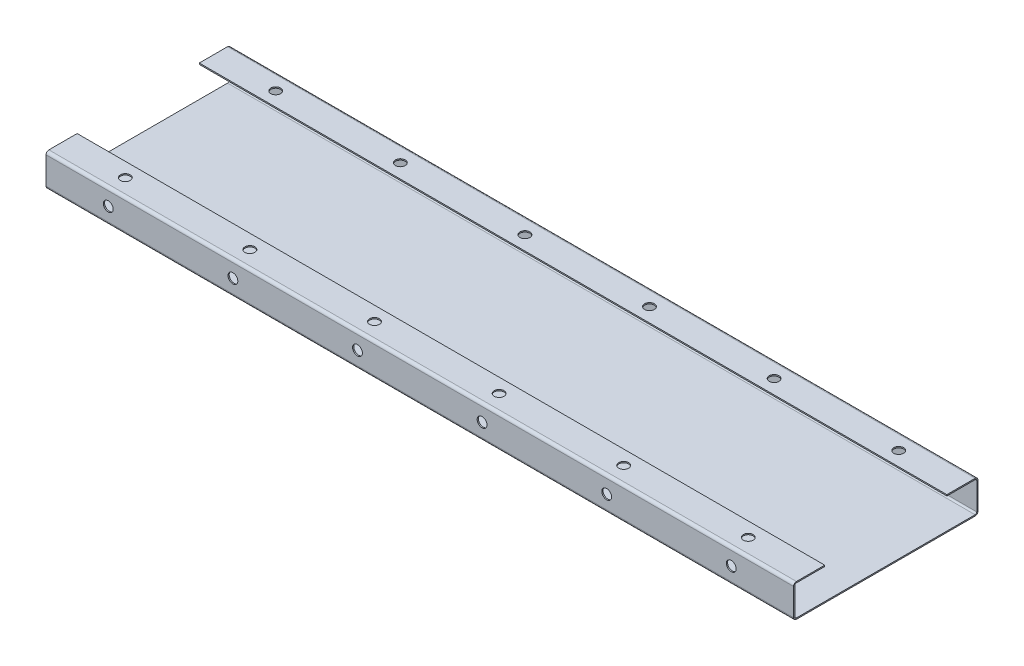
from build123d import *

# Parameters (mm, degrees)
SKETCH1_W                      = 912
SKETCH1_H                      = 225
BASE_FLANGE1_DEPTH             = 1.5
EDGE_FLANGE1_STRIP_W           = 10
EDGE_FLANGE1_STRIP_H           = 1.5
EDGE_FLANGE1_STRIP_CUT_DEPTH   = 912
EDGE_FLANGE1_STRIP_2_W         = 10
EDGE_FLANGE1_STRIP_2_H         = 1.5
EDGE_FLANGE1_STRIP_CUT_2_DEPTH = 912
EDGE_FLANGE1_DEPTH             = 912
EDGE_FLANGE1_BEND_DEPTH        = 912
EDGE_FLANGE2_STRIP_W           = 10
EDGE_FLANGE2_STRIP_H           = 1.5
EDGE_FLANGE2_STRIP_CUT_DEPTH   = 912
EDGE_FLANGE2_STRIP_2_W         = 10
EDGE_FLANGE2_STRIP_2_H         = 1.5
EDGE_FLANGE2_STRIP_CUT_2_DEPTH = 912
EDGE_FLANGE2_DEPTH             = 912
EDGE_FLANGE2_BEND_DEPTH        = 912
SKETCH18_R                     = 6
CUT_EXTRUDE1_DEPTH             = 280
SKETCH19_R                     = 6
CUT_EXTRUDE2_DEPTH             = 5


# Sheet-metal steps are written as plain solids
with BuildPart() as part:
    # Sketch1 → Base-Flange1 (new body)
    with BuildSketch(Plane(origin=(0, 0, 0), x_dir=(1, 0, 0), z_dir=(0, 1, 0))):
        Rectangle(SKETCH1_W, SKETCH1_H)
    extrude(amount=-BASE_FLANGE1_DEPTH)

    # Edge-Flange1 strip (across the edge) → Edge-Flange1 strip cut (cut)
    with BuildSketch(Plane(origin=(-456, 0, 112.5), x_dir=(0, 0, -1), z_dir=(1, 0, 0))):
        with Locations((-1.5, -0.75)):
            Rectangle(EDGE_FLANGE1_STRIP_W, EDGE_FLANGE1_STRIP_H)
    extrude(amount=EDGE_FLANGE1_STRIP_CUT_DEPTH, mode=Mode.SUBTRACT)

    # Edge-Flange1 strip 2 (across the edge) → Edge-Flange1 strip cut 2 (cut)
    with BuildSketch(Plane(origin=(456, 0, -112.5), x_dir=(0, 0, 1), z_dir=(-1, 0, 0))):
        with Locations((-1.5, -0.75)):
            Rectangle(EDGE_FLANGE1_STRIP_2_W, EDGE_FLANGE1_STRIP_2_H)
    extrude(amount=EDGE_FLANGE1_STRIP_CUT_2_DEPTH, mode=Mode.SUBTRACT)

    # Edge-Flange1 section (across the edge) → Edge-Flange1 (add)
    with BuildSketch(Plane(origin=(-456, 0, 112.5), x_dir=(0, 0, -1), z_dir=(1, 0, 0))):
        with BuildLine():
            Line((0, 2), (0, 38.5))
            Line((0, 38.5), (1.5, 38.5))
            Line((1.5, 38.5), (1.5, 2))
            ThreePointArc((1.5, 2), (2.085786438, 0.585786438), (3.5, 0))
            Line((3.5, 0), (3.5, -1.5))
            ThreePointArc((3.5, -1.5), (1.025126266, -0.474873734), (0, 2))
        make_face()
    extrude(amount=EDGE_FLANGE1_DEPTH)

    # Edge-Flange1 section 2 (across the edge) → Edge-Flange1 bend (add)
    with BuildSketch(Plane(origin=(456, 0, -112.5), x_dir=(0, 0, 1), z_dir=(-1, 0, 0))):
        with BuildLine():
            Line((0, 2), (0, 38.5))
            Line((0, 38.5), (1.5, 38.5))
            Line((1.5, 38.5), (1.5, 2))
            ThreePointArc((1.5, 2), (2.085786438, 0.585786438), (3.5, 0))
            Line((3.5, 0), (3.5, -1.5))
            ThreePointArc((3.5, -1.5), (1.025126266, -0.474873734), (0, 2))
        make_face()
    extrude(amount=EDGE_FLANGE1_BEND_DEPTH)

    # Edge-Flange2 strip (across the edge) → Edge-Flange2 strip cut (cut)
    with BuildSketch(Plane(origin=(-456, 38.5, 111), x_dir=(0, -1, 0), z_dir=(1, 0, 0))):
        with Locations((-1.5, -0.75)):
            Rectangle(EDGE_FLANGE2_STRIP_W, EDGE_FLANGE2_STRIP_H)
    extrude(amount=EDGE_FLANGE2_STRIP_CUT_DEPTH, mode=Mode.SUBTRACT)

    # Edge-Flange2 strip 2 (across the edge) → Edge-Flange2 strip cut 2 (cut)
    with BuildSketch(Plane(origin=(456, 38.5, -111), x_dir=(0, -1, 0), z_dir=(-1, 0, 0))):
        with Locations((-1.5, -0.75)):
            Rectangle(EDGE_FLANGE2_STRIP_2_W, EDGE_FLANGE2_STRIP_2_H)
    extrude(amount=EDGE_FLANGE2_STRIP_CUT_2_DEPTH, mode=Mode.SUBTRACT)

    # Edge-Flange2 section (across the edge) → Edge-Flange2 (add)
    with BuildSketch(Plane(origin=(-456, 38.5, 111), x_dir=(0, -1, 0), z_dir=(1, 0, 0))):
        with BuildLine():
            Line((0, 2), (0, 36.5))
            Line((0, 36.5), (1.5, 36.5))
            Line((1.5, 36.5), (1.5, 2))
            ThreePointArc((1.5, 2), (2.085786438, 0.585786438), (3.5, 0))
            Line((3.5, 0), (3.5, -1.5))
            ThreePointArc((3.5, -1.5), (1.025126266, -0.474873734), (0, 2))
        make_face()
    extrude(amount=EDGE_FLANGE2_DEPTH)

    # Edge-Flange2 section 2 (across the edge) → Edge-Flange2 bend (add)
    with BuildSketch(Plane(origin=(456, 38.5, -111), x_dir=(0, -1, 0), z_dir=(-1, 0, 0))):
        with BuildLine():
            Line((0, 2), (0, 36.5))
            Line((0, 36.5), (1.5, 36.5))
            Line((1.5, 36.5), (1.5, 2))
            ThreePointArc((1.5, 2), (2.085786438, 0.585786438), (3.5, 0))
            Line((3.5, 0), (3.5, -1.5))
            ThreePointArc((3.5, -1.5), (1.025126266, -0.474873734), (0, 2))
        make_face()
    extrude(amount=EDGE_FLANGE2_BEND_DEPTH)

    # Sketch18 → Cut-Extrude1 (cut)
    with BuildSketch(Plane.XY.offset(112.5)):
        with Locations((380, 18.5)):
            Circle(SKETCH18_R)
        with Locations((228, 18.5)):
            Circle(SKETCH18_R)
        with Locations((76, 18.5)):
            Circle(SKETCH18_R)
        with Locations((-76, 18.5)):
            Circle(SKETCH18_R)
        with Locations((-228, 18.5)):
            Circle(SKETCH18_R)
        with Locations((-380, 18.5)):
            Circle(SKETCH18_R)
    extrude(amount=-CUT_EXTRUDE1_DEPTH, mode=Mode.SUBTRACT)

    # Sketch19 → Cut-Extrude2 (cut)
    with BuildSketch(Plane(origin=(0, 38.5, 0), x_dir=(1, 0, 0), z_dir=(0, 1, 0))):
        with Locations(Location((-380, -91.75, 0), (0, 0, 270))):
            Circle(SKETCH19_R)
        with Locations(Location((-228, -91.75, 0), (0, 0, 270))):
            Circle(SKETCH19_R)
        with Locations(Location((-76, -91.75, 0), (0, 0, 270))):
            Circle(SKETCH19_R)
        with Locations(Location((76, -91.75, 0), (0, 0, 270))):
            Circle(SKETCH19_R)
        with Locations(Location((228, -91.75, 0), (0, 0, 270))):
            Circle(SKETCH19_R)
        with Locations(Location((380, -91.75, 0), (0, 0, 270))):
            Circle(SKETCH19_R)
        with Locations(Location((380, 91.75, 0), (0, 0, 90))):
            Circle(SKETCH19_R)
        with Locations(Location((228, 91.75, 0), (0, 0, 90))):
            Circle(SKETCH19_R)
        with Locations(Location((76, 91.75, 0), (0, 0, 90))):
            Circle(SKETCH19_R)
        with Locations(Location((-76, 91.75, 0), (0, 0, 90))):
            Circle(SKETCH19_R)
        with Locations(Location((-228, 91.75, 0), (0, 0, 90))):
            Circle(SKETCH19_R)
        with Locations(Location((-380, 91.75, 0), (0, 0, 90))):
            Circle(SKETCH19_R)
    extrude(amount=-CUT_EXTRUDE2_DEPTH, mode=Mode.SUBTRACT)


solid = part.part
